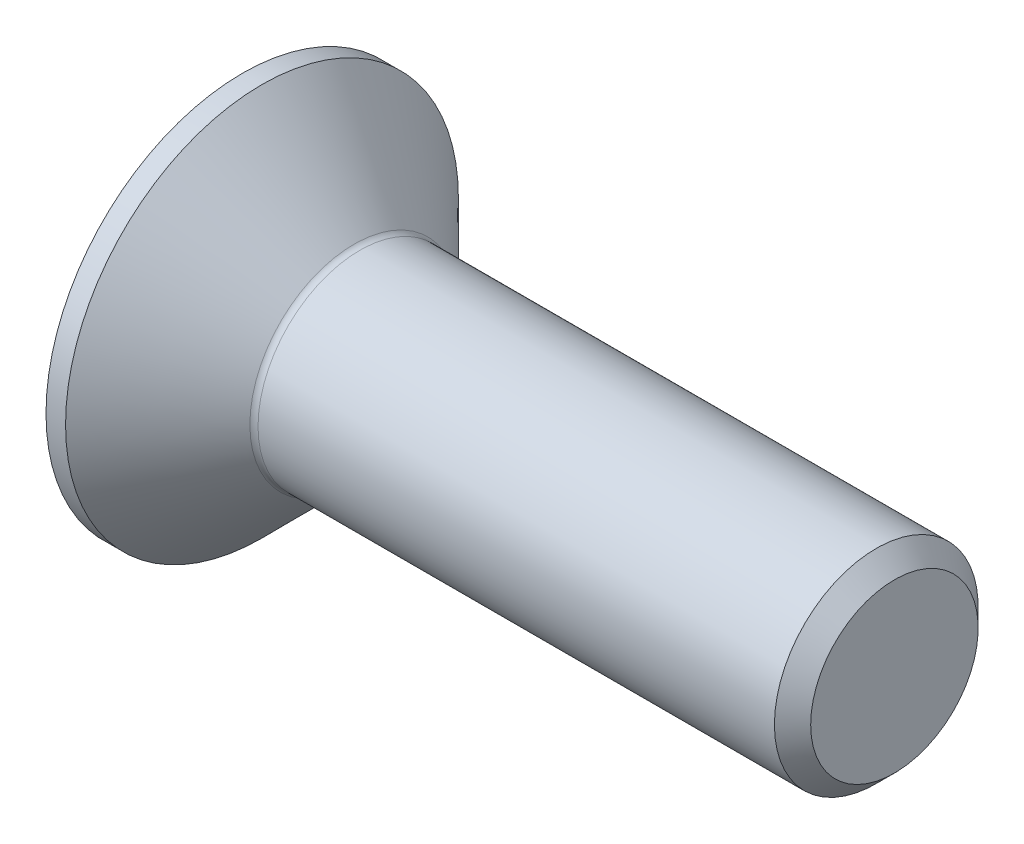
from build123d import *

# Parameters (mm, degrees)
FILLET1_R   = 0.2
HEX_START   = -2.3
HEX_2_DEPTH = 2.3


with BuildPart() as part:
    # BodySke → BaseBody (revolve)
    with BuildSketch(Plane.XY, mode=Mode.PRIVATE) as basebody_sk:
        Polygon((0, 0), (0, 4.82), (0.48, 4.82), (2.8, 2.5), (15.555, 2.5), (16, 2.055), (16, 0), align=None)
    revolve(basebody_sk.sketch.rotate(Axis((0, 0, 0), (1, 0, 0)), 90), axis=Axis((0, 0, 0), (1, 0, 0)))

    # Fillet1
    fillet1_edges = [part.edges().sort_by_distance(p)[0] for p in [
        (2.8, 0, -2.5),
    ]]
    fillet(fillet1_edges, radius=FILLET1_R)

    # Hex 2: read off the stored shape, not the designer's step
    # Hex 2 outline → Hex 2 (cut)
    with BuildSketch(Plane.ZY.offset(HEX_START)):
        Polygon((-1.51, -0.871798906), (0, -1.743597813), (1.51, -0.871798906), (1.51, 0.871798906), (0, 1.743597813), (-1.51, 0.871798906), align=None)
    extrude(amount=HEX_2_DEPTH, mode=Mode.SUBTRACT)

    # Hex 2 2 outline → Hex 2 2 (revolve, cut)
    with BuildSketch(Plane.YX):
        Polygon((1.51, 2.3), (0, 3.171798906), (0, 2.3), align=None)
    revolve(axis=Axis((0, 0, 0), (1, 0, 0)), mode=Mode.SUBTRACT)


solid = part.part
